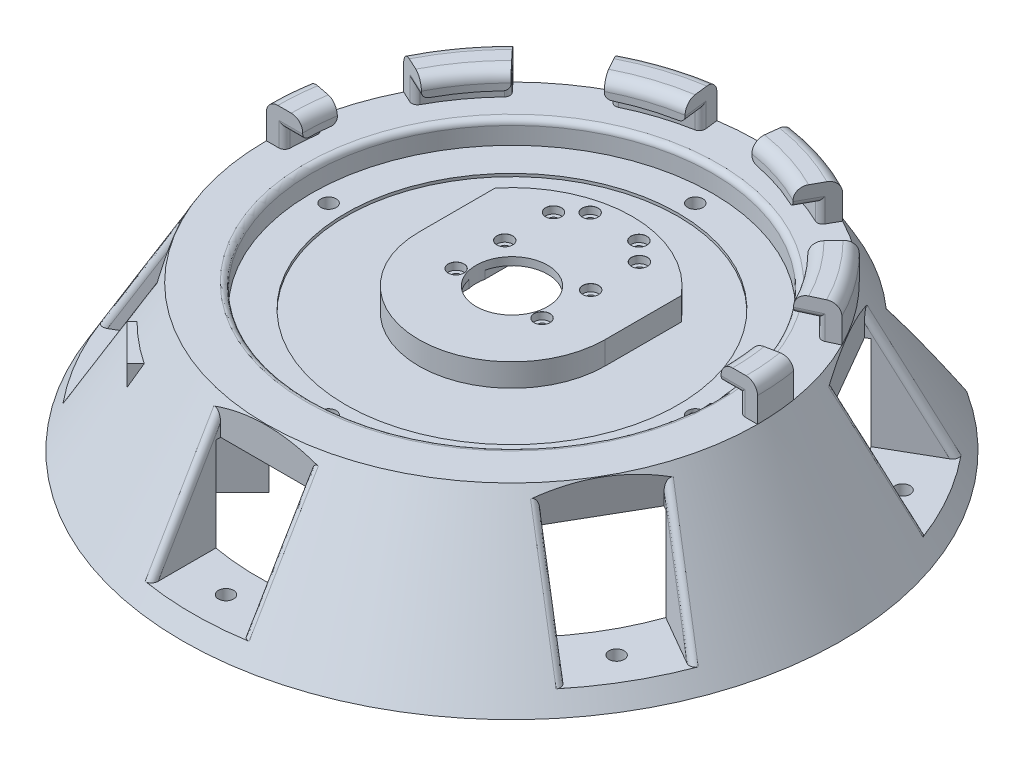
from build123d import *

# Parameters (mm, degrees)
SKETCH2_R                       = 12.5
CUT_EXTRUDE1_DEPTH              = 171.457229262
SKETCH3_R                       = 69.999999954
CUT_EXTRUDE2_DEPTH              = 8.000000002
CUT_EXTRUDE5_DEPTH              = 39
SKETCH8_W                       = 31.75
SKETCH8_H                       = 38.1
CUT_EXTRUDE6_DEPTH              = 44.45
CIRPATTERN2_COUNT               = 6
SKETCH9_R                       = 2.649982
CUT_EXTRUDE7_DEPTH              = 171.457229262
CIRPATTERN3_COUNT               = 6
REVOLVE2_ANGLE                  = 180
CUT_EXTRUDE9_DEPTH              = 12.7
SKETCH3_3_R                     = 12.5
CUT_EXTRUDE11_DEPTH             = 1
CBORE_FOR_M2_5_SHCS1_AT_2_COUNT = 2
CBORE_FOR_M2_5_SHCS1_AT_2_PITCH = 17
CBORE_FOR_M2_5_SHCS1_AT_3_COUNT = 2
CBORE_FOR_M2_5_SHCS1_AT_3_PITCH = 34
CBORE_FOR_M2_5_SHCS1_AT_4_COUNT = 2
CBORE_FOR_M2_5_SHCS1_AT_4_PITCH = 40.820828017
CBORE_FOR_M2_5_SHCS1_AT_5_COUNT = 2
CBORE_FOR_M2_5_SHCS1_AT_5_PITCH = 46.651259361
CBORE_FOR_M2_5_SHCS1_AT_6_COUNT = 2
CBORE_FOR_M2_5_SHCS1_AT_6_PITCH = 45.343136195
CBORE_FOR_M2_5_SHCS1_AT_7_COUNT = 2
CBORE_FOR_M2_5_SHCS1_AT_7_PITCH = 34.481879299
CBORE_FOR_M2_5_SHCS1_AT_8_COUNT = 2
CBORE_FOR_M2_5_SHCS1_AT_8_PITCH = 30
FILLET1_R                       = 4
FILLET2_R                       = 2
FILLET3_R                       = 2
FILLET4_R                       = 2
FILLET5_R                       = 2
FILLET9_R                       = 1
CUT_EXTRUDE12_DEPTH             = 8.05
CUT_EXTRUDE15_START             = -5.3
SKETCH20_R                      = 1.45
CUT_EXTRUDE15_DEPTH             = 5.3
M5_CLEARANCE_HOLE1_D            = 5.3
SKETCH34_R                      = 58
CUT_EXTRUDE16_DEPTH             = 1
BOSS_EXTRUDE1_DEPTH             = 39
FILLET10_R                      = 10


with BuildPart() as part:
    # Sketch1 → Revolve1 (revolve)
    with BuildSketch(Plane.XY, mode=Mode.PRIVATE) as revolve1_sk:
        Polygon((0, 0), (-85.725, 0), (-115.054393675, -50.8), (0, -50.8), align=None)
    revolve(revolve1_sk.sketch.rotate(Axis((0, 0, 0), (0, -1, 0)), 270), axis=Axis((0, 0, 0), (0, -1, 0)))

    # Sketch2 → Cut-Extrude1 (cut, through all)
    with BuildSketch(Plane(origin=(0, 0, 0), x_dir=(1, 0, 0), z_dir=(0, 1, 0))):
        with Locations(Location((0, 0, 0), (0, 0, 270))):
            Circle(SKETCH2_R)
    extrude(amount=-CUT_EXTRUDE1_DEPTH, mode=Mode.SUBTRACT)

    # Sketch3 → Cut-Extrude2 (cut)
    with BuildSketch(Plane(origin=(0, 0, 0), x_dir=(1, 0, 0), z_dir=(0, 1, 0))):
        with Locations(Location((0, 0, 0), (0, 0, 270))):
            Circle(SKETCH3_R)
        with BuildLine():
            ThreePointArc((32.5, 0), (0, -32.5), (-32.5, 0))
            Line((-32.5, 0), (-32.5, 26.603571189))
            ThreePointArc((-32.5, 26.603571189), (0, 42), (32.5, 26.603571189))
            Line((32.5, 26.603571189), (32.5, 0))
        make_face(mode=Mode.SUBTRACT)
    extrude(amount=-CUT_EXTRUDE2_DEPTH, mode=Mode.SUBTRACT)

    # Sketch7 → Cut-Extrude5 (cut)
    with BuildSketch(Plane.XZ.offset(50.8)):
        with BuildLine():
            Line((-60, -65.598856697), (-60, -161.1))
            Line((-60, -161.1), (60, -161.1))
            Line((60, -161.1), (60, -65.598856697))
            ThreePointArc((60, -65.598856697), (0, 88.9), (-60, -65.598856697))
        make_face()
    extrude(amount=-CUT_EXTRUDE5_DEPTH, mode=Mode.SUBTRACT)

    # Sketch8 → Cut-Extrude6 (cut)
    with BuildSketch(Plane(origin=(0, 0, 0), x_dir=(1, 0, 0), z_dir=(0, 1, 0))):
        with Locations((0, -104.875)):
            Rectangle(SKETCH8_W, SKETCH8_H)
    cut_extrude6 = extrude(amount=-CUT_EXTRUDE6_DEPTH, mode=Mode.SUBTRACT)

    # CirPattern2: Cut-Extrude6 ×6 about axis, 1 skipped
    cirpattern2_axis = Axis((0, 0, 0), (0, -1, 0))
    add([cut_extrude6.rotate(cirpattern2_axis, i * 360 / CIRPATTERN2_COUNT) for i in range(1, CIRPATTERN2_COUNT) if i not in (3,)], mode=Mode.SUBTRACT)

    # Sketch9 → Cut-Extrude7 (cut, through all)
    with BuildSketch(Plane(origin=(0, 0, 0), x_dir=(1, 0, 0), z_dir=(0, 1, 0))):
        with Locations(Location((0, -99.814393675, 0), (0, 0, 270))):
            Circle(SKETCH9_R)
    cut_extrude7 = extrude(amount=-CUT_EXTRUDE7_DEPTH, mode=Mode.SUBTRACT)

    # CirPattern3: Cut-Extrude7 ×6 about axis
    cirpattern3_axis = Axis((0, 0, 0), (0, 1, 0))
    for i in range(1, CIRPATTERN3_COUNT):
        add(cut_extrude7.rotate(cirpattern3_axis, i * 360 / CIRPATTERN3_COUNT), mode=Mode.SUBTRACT)

    # Sketch12 → Revolve2 (revolve)
    with BuildSketch(Plane.XY):
        Polygon((85.725, 0), (85.725, 12.7), (73.025, 12.7), (73.025, 6.35), (79.375, 6.35), (79.375, 0), align=None)
    revolve(axis=Axis((0, 0, 0), (0, 1, 0)), revolution_arc=REVOLVE2_ANGLE)

    # Sketch18 → Cut-Extrude9 (cut)
    with BuildSketch(Plane(origin=(0, 12.7, 0), x_dir=(1, 0, 0), z_dir=(0, 1, 0))):
        Polygon((46.643270314, 89.718478222), (70.913780145, 72.084920653), (36.670415564, 35.160782448), (22.108109665, 45.740916989), align=None)
        Polygon((-15, 100), (-9, 50), (9, 50), (15, 100), align=None)
        Polygon((90.470396714, 45.167547182), (99.740906545, 16.635851693), (50.333978764, 6.891341072), (44.771672865, 24.010358365), align=None)
        Polygon((99.740906545, -16.635851693), (90.470396714, -45.167547182), (44.771672865, -24.010358365), (50.333978764, -6.891341072), align=None)
        Polygon((70.913780145, -72.084920653), (46.643270314, -89.718478222), (22.108109665, -45.740916989), (36.670415564, -35.160782448), align=None)
        Polygon((15, -100), (-15, -100), (-9, -50), (9, -50), align=None)
        Polygon((-46.643270314, -89.718478222), (-70.913780145, -72.084920653), (-36.670415564, -35.160782448), (-22.108109665, -45.740916989), align=None)
        Polygon((-90.470396714, -45.167547182), (-99.740906545, -16.635851693), (-50.333978764, -6.891341072), (-44.771672865, -24.010358365), align=None)
        Polygon((-99.740906545, 16.635851693), (-90.470396714, 45.167547182), (-44.771672865, 24.010358365), (-50.333978764, 6.891341072), align=None)
        Polygon((-70.913780145, 72.084920653), (-46.643270314, 89.718478222), (-22.108109665, 45.740916989), (-36.670415564, 35.160782448), align=None)
    extrude(amount=-CUT_EXTRUDE9_DEPTH, mode=Mode.SUBTRACT)

    # Sketch3<3> → Cut-Extrude11 (cut)
    # profile 1 of 5: a face of its own
    with BuildSketch(Plane(origin=(0, 0, 0), x_dir=(1, 0, 0), z_dir=(0, 1, 0))):
        with BuildLine():
            ThreePointArc((-18.668154703, 26.603571189), (-28.835438507, 14.992247533), (-32.5, 0))
            ThreePointArc((-32.5, 0), (0, -32.5), (32.5, 0))
            ThreePointArc((32.5, 0), (28.835438507, 14.992247533), (18.668154703, 26.603571189))
            Line((18.668154703, 26.603571189), (-18.668154703, 26.603571189))
        make_face()
        with Locations(Location((0, 0, 0), (0, 0, 270))):
            Circle(SKETCH3_3_R, mode=Mode.SUBTRACT)
    # profile 2 of 5: a face of its own
    with BuildSketch(Plane(origin=(0, 0, 0), x_dir=(1, 0, 0), z_dir=(0, 1, 0))):
        with BuildLine():
            Line((-32.5, 26.603571189), (-32.5, 0))
            ThreePointArc((-32.5, 0), (-28.835438507, 14.992247533), (-18.668154703, 26.603571189))
            Line((-18.668154703, 26.603571189), (-32.5, 26.603571189))
        make_face()
    # profile 3 of 5: a face of its own
    with BuildSketch(Plane(origin=(0, 0, 0), x_dir=(1, 0, 0), z_dir=(0, 1, 0))):
        with BuildLine():
            ThreePointArc((18.668154703, 26.603571189), (0, 32.5), (-18.668154703, 26.603571189))
            Line((-18.668154703, 26.603571189), (18.668154703, 26.603571189))
        make_face()
    # profile 4 of 5: a face of its own
    with BuildSketch(Plane(origin=(0, 0, 0), x_dir=(1, 0, 0), z_dir=(0, 1, 0))):
        with BuildLine():
            ThreePointArc((32.5, 26.603571189), (0, 42), (-32.5, 26.603571189))
            Line((-32.5, 26.603571189), (-18.668154703, 26.603571189))
            ThreePointArc((-18.668154703, 26.603571189), (0, 32.5), (18.668154703, 26.603571189))
            Line((18.668154703, 26.603571189), (32.5, 26.603571189))
        make_face()
    # profile 5 of 5: a face of its own
    with BuildSketch(Plane(origin=(0, 0, 0), x_dir=(1, 0, 0), z_dir=(0, 1, 0))):
        with BuildLine():
            ThreePointArc((18.668154703, 26.603571189), (28.835438507, 14.992247533), (32.5, 0))
            Line((32.5, 0), (32.5, 26.603571189))
            Line((32.5, 26.603571189), (18.668154703, 26.603571189))
        make_face()
    extrude(amount=-CUT_EXTRUDE11_DEPTH, mode=Mode.SUBTRACT)

    # Sketch24 → CBORE for M2.5 SHCS1 (revolve, cut)
    with BuildSketch(Plane(origin=(-15, -1, 4.5), x_dir=(0, 0, 1), z_dir=(1, 0, 0))):
        Polygon((0, 0), (0, 49.8), (1.45, 49.8), (1.45, 2.5), (2.75, 2.5), (2.75, 0.025), (2.775, 0), align=None)
    cbore_for_m2_5_shcs1 = revolve(axis=Axis((-15, 5.35, 4.5), (0, -1, 0)), mode=Mode.SUBTRACT)

    # CBORE for M2.5 SHCS1 at 2: CBORE for M2.5 SHCS1 ×2
    with Locations(*[(0, 0, -i * CBORE_FOR_M2_5_SHCS1_AT_2_PITCH) for i in range(1, CBORE_FOR_M2_5_SHCS1_AT_2_COUNT)]):
        add(cbore_for_m2_5_shcs1, mode=Mode.SUBTRACT)

    # CBORE for M2.5 SHCS1 at 3: CBORE for M2.5 SHCS1 ×2
    with Locations(*[(0, 0, -i * CBORE_FOR_M2_5_SHCS1_AT_3_PITCH) for i in range(1, CBORE_FOR_M2_5_SHCS1_AT_3_COUNT)]):
        add(cbore_for_m2_5_shcs1, mode=Mode.SUBTRACT)

    # CBORE for M2.5 SHCS1 at 4: CBORE for M2.5 SHCS1 ×2
    with Locations(*[Vector(0.15923243882462063, 0, -0.9872411207126472) * (i * CBORE_FOR_M2_5_SHCS1_AT_4_PITCH) for i in range(1, CBORE_FOR_M2_5_SHCS1_AT_4_COUNT)]):
        add(cbore_for_m2_5_shcs1, mode=Mode.SUBTRACT)

    # CBORE for M2.5 SHCS1 at 5: CBORE for M2.5 SHCS1 ×2
    with Locations(*[Vector(0.5037377408822789, 0, -0.8638566364917376) * (i * CBORE_FOR_M2_5_SHCS1_AT_5_PITCH) for i in range(1, CBORE_FOR_M2_5_SHCS1_AT_5_COUNT)]):
        add(cbore_for_m2_5_shcs1, mode=Mode.SUBTRACT)

    # CBORE for M2.5 SHCS1 at 6: CBORE for M2.5 SHCS1 ×2
    with Locations(*[Vector(0.6616216370868465, 0, -0.7498378553650925) * (i * CBORE_FOR_M2_5_SHCS1_AT_6_PITCH) for i in range(1, CBORE_FOR_M2_5_SHCS1_AT_6_COUNT)]):
        add(cbore_for_m2_5_shcs1, mode=Mode.SUBTRACT)

    # CBORE for M2.5 SHCS1 at 7: CBORE for M2.5 SHCS1 ×2
    with Locations(*[Vector(0.8700221858486125, 0, -0.4930125719808802) * (i * CBORE_FOR_M2_5_SHCS1_AT_7_PITCH) for i in range(1, CBORE_FOR_M2_5_SHCS1_AT_7_COUNT)]):
        add(cbore_for_m2_5_shcs1, mode=Mode.SUBTRACT)

    # CBORE for M2.5 SHCS1 at 8: CBORE for M2.5 SHCS1 ×2
    with Locations(*[(i * CBORE_FOR_M2_5_SHCS1_AT_8_PITCH, 0, 0) for i in range(1, CBORE_FOR_M2_5_SHCS1_AT_8_COUNT)]):
        add(cbore_for_m2_5_shcs1, mode=Mode.SUBTRACT)

    # Fillet1
    fillet1_edges = [part.edges().sort_by_distance(p)[0] for p in [
        (-85.450905057, 12.7, -6.849704366),
        (-72.808821363, 12.7, -5.614815819),
        (-59.078466014, 12.7, -42.923018049),
        (-22.565966014, 12.7, -69.450902102),
        (22.565966014, 12.7, -69.450902102),
        (59.078466014, 12.7, -42.923018049),
        (72.808821363, 12.7, -5.614815819),
        (-69.352981843, 12.7, -50.387890753),
        (-26.490481843, 12.7, -81.529319859),
        (26.490481843, 12.7, -81.529319859),
        (69.352981843, 12.7, -50.387890753),
        (85.450905057, 12.7, -6.849704365),
    ]]
    fillet(fillet1_edges, radius=FILLET1_R)

    # Fillet2
    fillet2_edges = [part.edges().sort_by_distance(p)[0] for p in [
        (-76.2, 6.35, 0),
        (76.2, 6.35, 0),
        (67.844410645, 6.35, -34.692369341),
        (75.278944251, 6.35, -11.811227656),
        (34.49561812, 6.35, -67.9446604),
        (53.95947979, 6.35, -53.803337137),
        (-75.278944251, 6.35, -11.811227656),
        (-67.844410645, 6.35, -34.692369341),
        (-53.95947979, 6.35, -53.803337137),
        (-34.49561812, 6.35, -67.9446604),
        (12.029328065, 6.35, -75.24440054),
        (-12.029328065, 6.35, -75.24440054),
    ]]
    fillet(fillet2_edges, radius=FILLET2_R)

    # Fillet3
    fillet3_edges = [part.edges().sort_by_distance(p)[0] for p in [
        (-78.396323126, 4.175, -12.426067172),
        (-56.120098678, 4.175, -56.133102082),
        (-70.727816733, 4.175, -36.027303052),
        (-12.407903987, 4.175, -78.399199892),
        (56.120098678, 4.175, -56.133102082),
        (78.396323126, 4.175, -12.426067171),
        (-79.375, 4.175, 0),
        (-36.043688298, 4.175, -70.719468033),
        (12.407903987, 4.175, -78.399199892),
        (36.043688298, 4.175, -70.719468033),
        (70.727816733, 4.175, -36.027303052),
        (79.375, 4.175, 0),
    ]]
    fillet(fillet3_edges, radius=FILLET3_R)

    # Fillet4
    fillet4_edges = [part.edges().sort_by_distance(p)[0] for p in [
        (92.853698409, -23.56380487, 35.278236725),
        (76.978698409, -23.56380487, 62.774543295),
        (76.978698409, -23.56380487, -62.774543295),
        (92.853698409, -23.56380487, -35.278236725),
        (-92.853698409, -23.56380487, -35.278236725),
        (-76.978698409, -23.56380487, -62.774543295),
        (-76.978698409, -23.56380487, 62.774543295),
        (-92.853698409, -23.56380487, 35.278236725),
        (15.875, -23.56380487, 98.05278002),
        (-15.875, -23.56380487, 98.05278002),
    ]]
    fillet(fillet4_edges, radius=FILLET4_R)

    # Fillet5
    fillet5_edges = [part.edges().sort_by_distance(p)[0] for p in [
        (0, 0, -69.999999954),
    ]]
    fillet(fillet5_edges, radius=FILLET5_R)

    # Fillet9
    fillet9_edges = [part.edges().sort_by_distance(p)[0] for p in [
        (-60, -31.116866881, -84.56763471),
        (60, -31.116866881, -84.56763471),
    ]]
    fillet(fillet9_edges, radius=FILLET9_R)

    # Sketch28 → Cut-Extrude12 (cut)
    with BuildSketch(Plane.XZ.offset(11.8)):
        with BuildLine():
            Line((9.2, 12), (-9.2, 12))
            ThreePointArc((-9.2, 12), (-11.321320344, 11.121320344), (-12.2, 9))
            Line((-12.2, 9), (-12.2, -30))
            ThreePointArc((-12.2, -30), (-11.321320344, -32.121320344), (-9.2, -33))
            Line((-9.2, -33), (9.2, -33))
            ThreePointArc((9.2, -33), (11.321320344, -32.121320344), (12.2, -30))
            Line((12.2, -30), (12.2, 9))
            ThreePointArc((12.2, 9), (11.321320344, 11.121320344), (9.2, 12))
        make_face()
    extrude(amount=-CUT_EXTRUDE12_DEPTH, mode=Mode.SUBTRACT)

    # Sketch20 → Cut-Extrude15 (cut)
    with BuildSketch(Plane.XZ.offset(11.8).offset(CUT_EXTRUDE15_START)):
        Polygon((-22.5, 23), (-22.5, -33), (-12.5, -40), (12.5, -40), (22.5, -33), (22.5, 23), align=None)
        with Locations(Location((-15, -29.5, 0), (0, 0, 90))):
            Circle(SKETCH20_R, mode=Mode.SUBTRACT)
        with Locations(Location((-8.5, -35.8, 0), (0, 0, 90))):
            Circle(SKETCH20_R, mode=Mode.SUBTRACT)
        with Locations(Location((-15, -12.5, 0), (0, 0, 90))):
            Circle(SKETCH20_R, mode=Mode.SUBTRACT)
        with Locations(Location((8.5, -35.8, 0), (0, 0, 90))):
            Circle(SKETCH20_R, mode=Mode.SUBTRACT)
        with Locations(Location((15, -29.5, 0), (0, 0, 90))):
            Circle(SKETCH20_R, mode=Mode.SUBTRACT)
        with BuildLine():
            Line((-9.2, 12), (-3.5, 12))
            ThreePointArc((-3.5, 12), (-1.767766953, 12.374368671), (0, 12.5))
            ThreePointArc((0, 12.5), (1.767766953, 12.374368671), (3.5, 12))
            Line((3.5, 12), (9.2, 12))
            ThreePointArc((9.2, 12), (11.321320344, 11.121320344), (12.2, 9))
            Line((12.2, 9), (12.2, 2.722131518))
            ThreePointArc((12.2, 2.722131518), (12.5, 0), (12.2, -2.722131518))
            Line((12.2, -2.722131518), (12.2, -30))
            ThreePointArc((12.2, -30), (11.321320344, -32.121320344), (9.2, -33))
            Line((9.2, -33), (-9.2, -33))
            ThreePointArc((-9.2, -33), (-11.321320344, -32.121320344), (-12.2, -30))
            Line((-12.2, -30), (-12.2, -2.722131518))
            ThreePointArc((-12.2, -2.722131518), (-12.5, 0), (-12.2, 2.722131518))
            Line((-12.2, 2.722131518), (-12.2, 9))
            ThreePointArc((-12.2, 9), (-11.321320344, 11.121320344), (-9.2, 12))
        make_face(mode=Mode.SUBTRACT)
        with Locations(Location((15, -12.5, 0), (0, 0, 90))):
            Circle(SKETCH20_R, mode=Mode.SUBTRACT)
        with Locations(Location((-15, 4.5, 0), (0, 0, 90))):
            Circle(SKETCH20_R, mode=Mode.SUBTRACT)
        with Locations(Location((15, 4.5, 0), (0, 0, 90))):
            Circle(SKETCH20_R, mode=Mode.SUBTRACT)
    extrude(amount=CUT_EXTRUDE15_DEPTH, mode=Mode.SUBTRACT)

    # M5 Clearance Hole1 (through all)
    with Locations(Plane(origin=(0, -8.000000002, 0), x_dir=(1, 0, 0), z_dir=(0, 1, 0))):
        with Locations((0, 64), (64, 0), (0, -64), (-64, 0)):
            Hole(M5_CLEARANCE_HOLE1_D / 2)

    # Sketch34 → Cut-Extrude16 (cut)
    with BuildSketch(Plane(origin=(0, -8.000000002, 0), x_dir=(1, 0, 0), z_dir=(0, 1, 0))):
        with Locations(Location((0, 0, 0), (0, 0, 270))):
            Circle(SKETCH34_R)
        with BuildLine():
            ThreePointArc((32.5, 0), (0, -32.5), (-32.5, 0))
            Line((-32.5, 0), (-32.5, 26.603571189))
            ThreePointArc((-32.5, 26.603571189), (0, 42), (32.5, 26.603571189))
            Line((32.5, 26.603571189), (32.5, 0))
        make_face(mode=Mode.SUBTRACT)
    extrude(amount=-CUT_EXTRUDE16_DEPTH, mode=Mode.SUBTRACT)

    # Sketch39 → Boss-Extrude1 (add)
    with BuildSketch(Plane.XZ.offset(50.8)):
        with BuildLine():
            ThreePointArc((62.861792847, 62.861792847), (56.138266806, 68.932612021), (48.831845645, 74.287689767))
            Line((48.831845645, 74.287689767), (29.69848481, 55.154328933))
            Line((29.69848481, 55.154328933), (42.426406871, 42.426406871))
            Line((42.426406871, 42.426406871), (62.861792847, 62.861792847))
        make_face()
        with BuildLine():
            ThreePointArc((88.016816575, -12.5), (88.9, 0), (88.016816575, 12.5))
            Line((88.016816575, 12.5), (72, 12.5))
            Line((72, 12.5), (72, -12.5))
            Line((72, -12.5), (88.016816575, -12.5))
        make_face()
        with BuildLine():
            Line((-72, 12.5), (-88.016816575, 12.5))
            ThreePointArc((-88.016816575, 12.5), (-88.9, 0), (-88.016816575, -12.5))
            Line((-88.016816575, -12.5), (-72, -12.5))
            Line((-72, -12.5), (-72, 12.5))
        make_face()
        Polygon((-67.175144213, 67.175144213), (-42.426406871, 42.426406871), (-29.69848481, 55.154328933), (-54.447222151, 79.903066274), align=None)
    extrude(amount=-BOSS_EXTRUDE1_DEPTH)

    # Fillet10
    fillet10_edges = [part.edges().sort_by_distance(p)[0] for p in [
        (36.062445841, -11.8, 48.790367902),
        (-36.062445841, -11.8, 48.790367902),
    ]]
    fillet(fillet10_edges, radius=FILLET10_R)


solid = part.part
